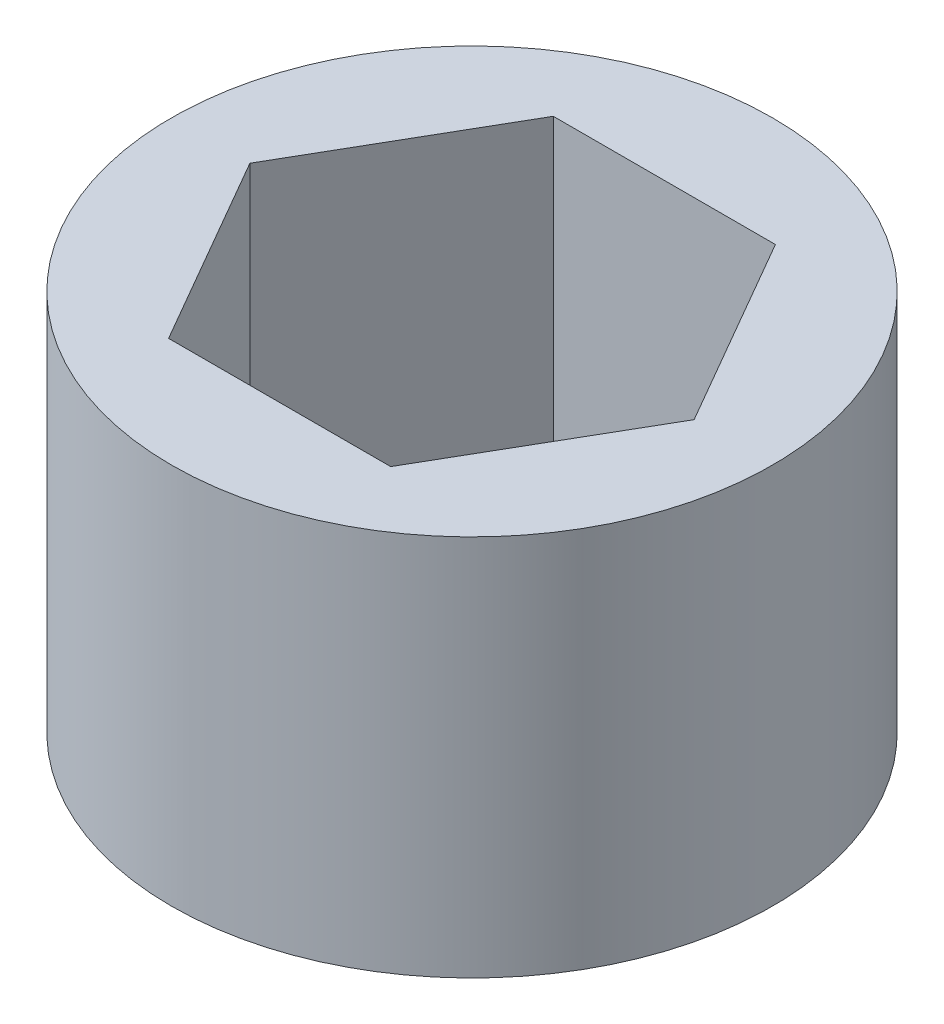
from build123d import *

# Parameters (mm, degrees)
SKETCH1_R           = 9.9949
BOSS_EXTRUDE1_DEPTH = 12.7


with BuildPart() as part:
    # Sketch1 → Boss-Extrude1 (new body)
    with BuildSketch(Plane(origin=(0, 0, 0), x_dir=(1, 0, 0), z_dir=(0, 1, 0))):
        Circle(SKETCH1_R)
        Polygon((7.383674858, 0), (3.691837429, 6.39445), (-3.691837429, 6.39445), (-7.383674858, 0), (-3.691837429, -6.39445), (3.691837429, -6.39445), align=None, mode=Mode.SUBTRACT)
    extrude(amount=BOSS_EXTRUDE1_DEPTH)


solid = part.part
